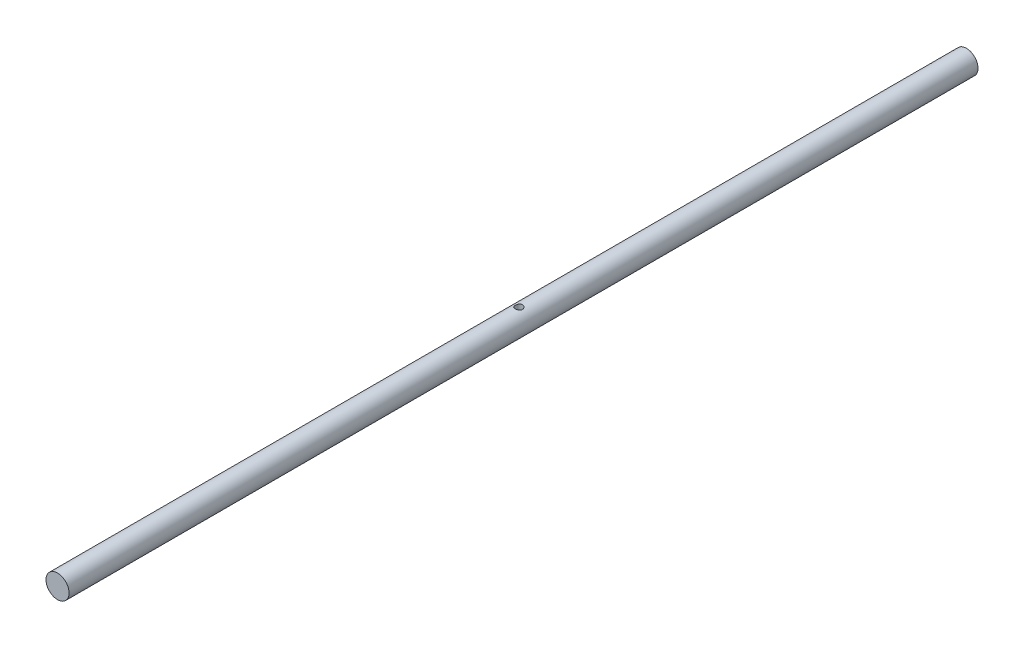
from build123d import *

# Parameters (mm, degrees)
SKETCH1_R               = 12.7
BOSS_EXTRUDE1_DEPTH     = 1000
CUT_EXTRUDE1_DEPTH      = 1001.161276995
CUT_EXTRUDE1_DEPTH_BACK = 1001.161276995
SKETCH2_R               = 3.96875


with BuildPart() as part:
    # Sketch1 → Boss-Extrude1 (new body)
    with BuildSketch(Plane.XY):
        Circle(SKETCH1_R)
    extrude(amount=BOSS_EXTRUDE1_DEPTH)

    # Sketch2 → Cut-Extrude1 (cut, two sides: drawn at the far end of the back side and taken through both)
    with BuildSketch(Plane(origin=(0, 0, 0), x_dir=(1, 0, 0), z_dir=(0, 1, 0)).offset(-CUT_EXTRUDE1_DEPTH_BACK)):
        with Locations((0, -492.5)):
            Circle(SKETCH2_R)
    extrude(amount=CUT_EXTRUDE1_DEPTH + CUT_EXTRUDE1_DEPTH_BACK, mode=Mode.SUBTRACT)


solid = part.part
